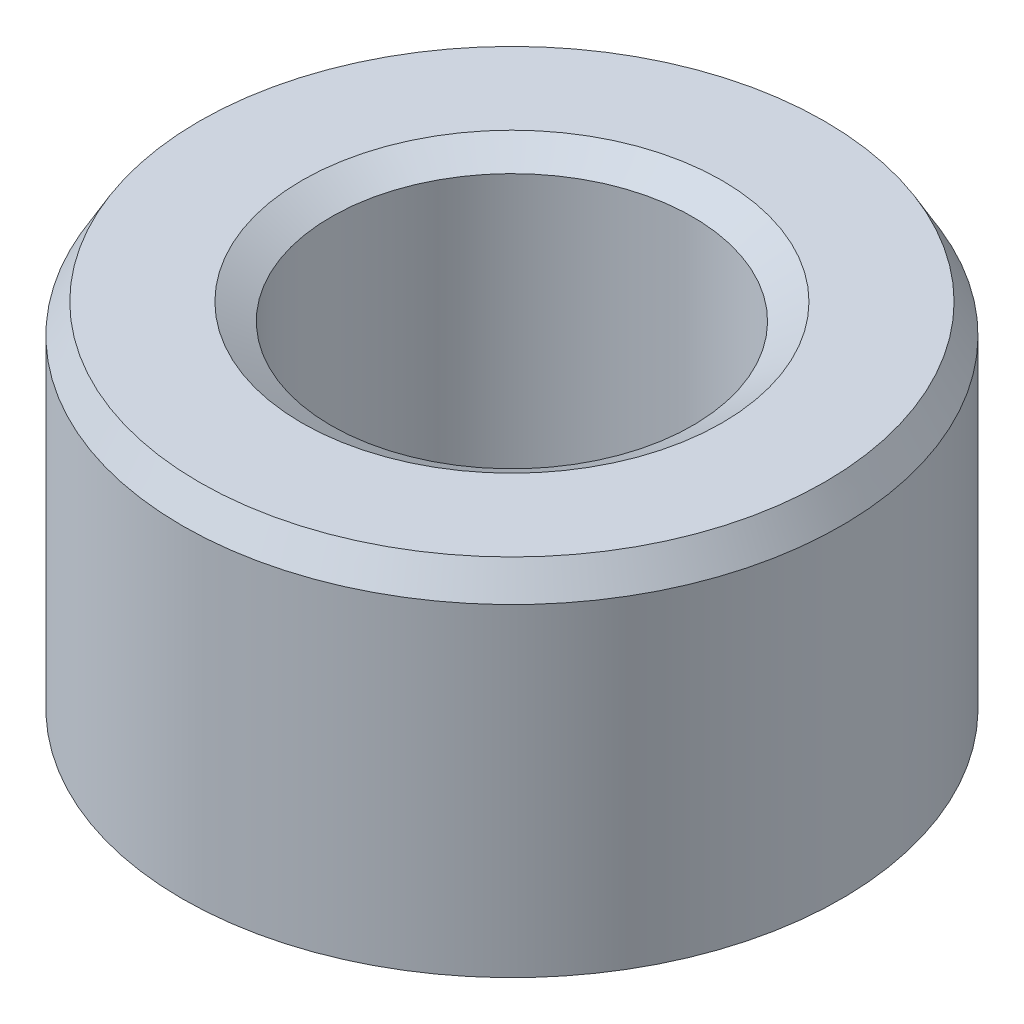
from build123d import *
from OCP.BRepFilletAPI import BRepFilletAPI_MakeChamfer

# Parameters (mm, degrees)
SKETCH1_R           = 37.5
BOSS_EXTRUDE1_DEPTH = 42.018753285
SKETCH2_R           = 20.570179401
CUT_EXTRUDE1_DEPTH  = 68.661478166
CHAMFER1_SIZE       = 3.331540028
CHAMFER1_SIZE2      = 1.923465532


with BuildPart() as part:
    # Sketch1 → Boss-Extrude1 (new body)
    with BuildSketch(Plane(origin=(0, 0, 0), x_dir=(1, 0, 0), z_dir=(0, 1, 0))):
        Circle(SKETCH1_R)
    extrude(amount=BOSS_EXTRUDE1_DEPTH)

    # Sketch2 → Cut-Extrude1 (cut, through all)
    with BuildSketch(Plane(origin=(0, 0, 0), x_dir=(1, 0, 0), z_dir=(0, 1, 0))):
        Circle(SKETCH2_R)
    extrude(amount=CUT_EXTRUDE1_DEPTH, mode=Mode.SUBTRACT)

    # Chamfer1: one chamfer whose edges measure the first distance from different faces: ONE call of the kernel's chamfer builder (chamfer() names one face for all edges)
    chamfer1_edges_1 = [part.edges().sort_by_distance(p)[0] for p in [
        (-20.570179401, 42.018753285, 0),
    ]]
    chamfer1_side_1 = [part.faces().sort_by_distance(p)[0] for p in [
        (-36.439339828, 42.018753285, 0),
    ]]
    chamfer1_edges_2 = [part.edges().sort_by_distance(p)[0] for p in [
        (-20.570179401, 0, 0),
    ]]
    chamfer1_side_2 = [part.faces().sort_by_distance(p)[0] for p in [
        (-20.570179401, 21.009376642, 0),
    ]]
    chamfer1_edges_3 = [part.edges().sort_by_distance(p)[0] for p in [
        (-37.5, 0, 0),
    ]]
    chamfer1_side_3 = [part.faces().sort_by_distance(p)[0] for p in [
        (-36.439339828, 0, 0),
    ]]
    chamfer1_edges_4 = [part.edges().sort_by_distance(p)[0] for p in [
        (-37.5, 42.018753285, 0),
    ]]
    chamfer1_side_4 = [part.faces().sort_by_distance(p)[0] for p in [
        (-37.5, 21.009376642, 0),
    ]]
    chamfer1 = BRepFilletAPI_MakeChamfer(part.part.solid().wrapped)
    for e in chamfer1_edges_1:
        chamfer1.Add(CHAMFER1_SIZE, CHAMFER1_SIZE2, e.wrapped, chamfer1_side_1[0].wrapped)  # the first distance lies on this face
    for e in chamfer1_edges_2:
        chamfer1.Add(CHAMFER1_SIZE, CHAMFER1_SIZE2, e.wrapped, chamfer1_side_2[0].wrapped)  # the first distance lies on this face
    for e in chamfer1_edges_3:
        chamfer1.Add(CHAMFER1_SIZE, CHAMFER1_SIZE2, e.wrapped, chamfer1_side_3[0].wrapped)  # the first distance lies on this face
    for e in chamfer1_edges_4:
        chamfer1.Add(CHAMFER1_SIZE, CHAMFER1_SIZE2, e.wrapped, chamfer1_side_4[0].wrapped)  # the first distance lies on this face
    add(Compound.cast(chamfer1.Shape()), mode=Mode.REPLACE)


solid = part.part
